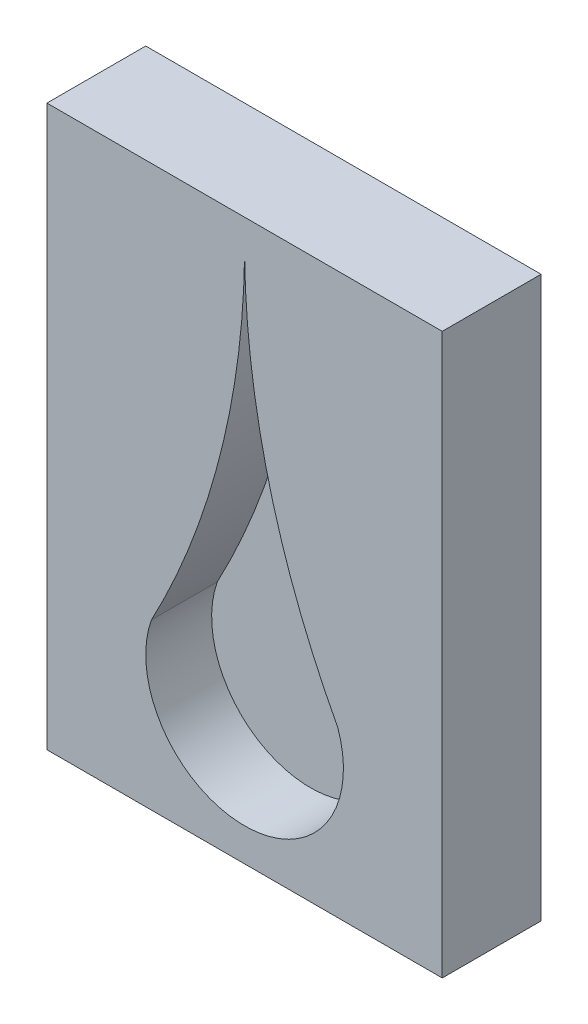
from build123d import *

# Parameters (mm, degrees)
SKETCH1_W           = 76.2
SKETCH1_H           = 107.95
BOSS_EXTRUDE1_DEPTH = 19.05
CUT_EXTRUDE1_DEPTH  = 12.7


with BuildPart() as part:
    # Sketch1 → Boss-Extrude1 (new body)
    with BuildSketch(Plane.XY):
        Rectangle(SKETCH1_W, SKETCH1_H)
    extrude(amount=BOSS_EXTRUDE1_DEPTH)

    # Sketch2 → Cut-Extrude1 (cut)
    with BuildSketch(Plane.XY.offset(19.05)):
        with BuildLine():
            ThreePointArc((-17.960512242, -22.225), (0, -47.625), (17.960512242, -22.225))
            ThreePointArc((17.960512242, -22.225), (4.788743426, 11.622237436), (0, 47.625))
            ThreePointArc((0, 47.625), (-4.788743426, 11.622237436), (-17.960512242, -22.225))
        make_face()
    extrude(amount=-CUT_EXTRUDE1_DEPTH, mode=Mode.SUBTRACT)


solid = part.part
